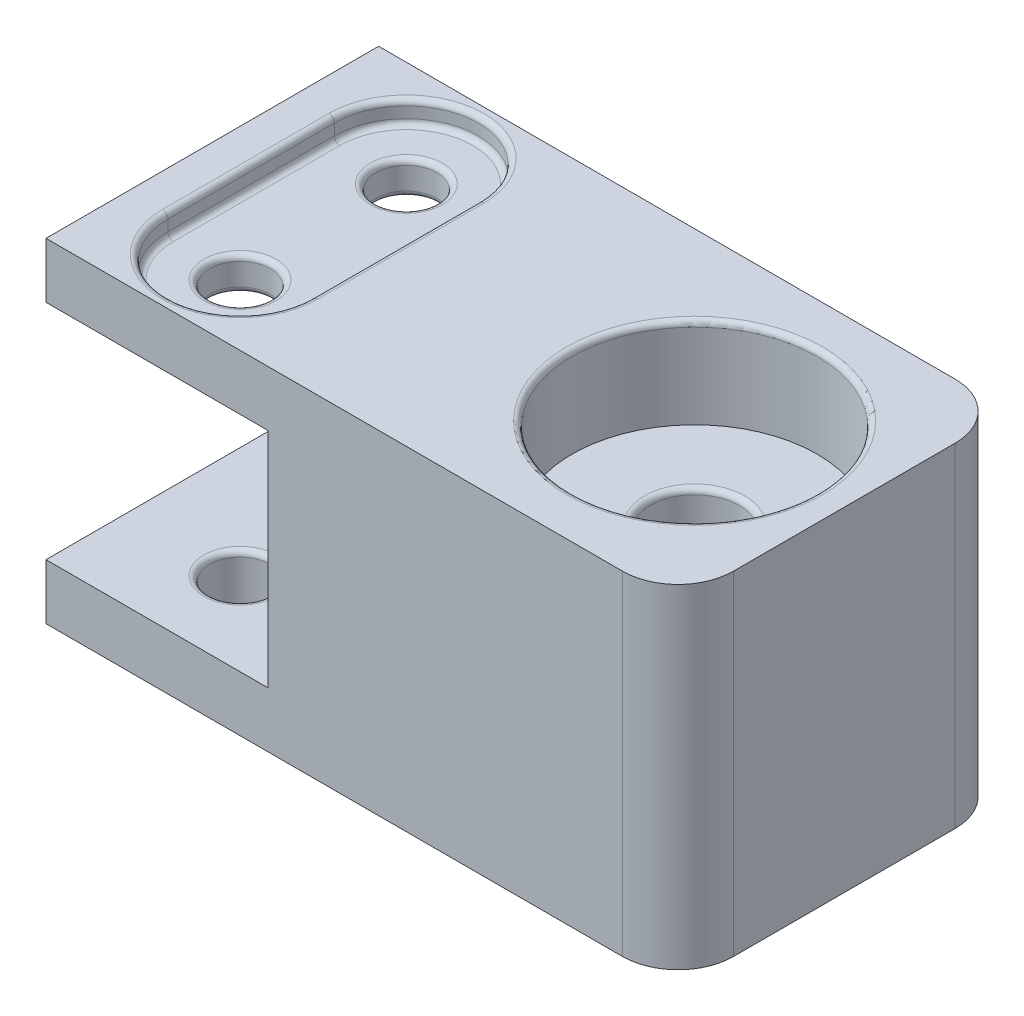
from build123d import *

# Parameters (mm, degrees)
SKETCH4_W           = 57
SKETCH4_H           = 30
BOSS_EXTRUDE2_DEPTH = 5
SKETCH5_W           = 37
SKETCH5_H           = 30
BOSS_EXTRUDE3_DEPTH = 20.1
BOSS_EXTRUDE4_DEPTH = 5
SKETCH7_R           = 2.75
CUT_EXTRUDE3_DEPTH  = 45.082422801
FILLET5_R           = 0.5
SKETCH8_R           = 11.049
CUT_EXTRUDE4_DEPTH  = 8.128
FILLET6_R           = 5
CUT_EXTRUDE5_START  = -8.128
SKETCH11_R          = 11.049
CUT_EXTRUDE5_DEPTH  = 8.128
SKETCH12_R          = 4.025
CUT_EXTRUDE6_DEPTH  = 39.987418278
FILLET7_R           = 0.5
CUT_EXTRUDE7_DEPTH  = 2
FILLET8_R           = 0.5


with BuildPart() as part:
    # Sketch4 → Boss-Extrude2 (new body)
    with BuildSketch(Plane(origin=(0, 0, 0), x_dir=(1, 0, 0), z_dir=(0, 1, 0))):
        Rectangle(SKETCH4_W, SKETCH4_H)
    extrude(amount=BOSS_EXTRUDE2_DEPTH)

    # Sketch5 → Boss-Extrude3 (add)
    with BuildSketch(Plane(origin=(0, 5, 0), x_dir=(1, 0, 0), z_dir=(0, 1, 0))):
        with Locations((10, 0)):
            Rectangle(SKETCH5_W, SKETCH5_H)
    extrude(amount=BOSS_EXTRUDE3_DEPTH)

    # Sketch6 → Boss-Extrude4 (add)
    with BuildSketch(Plane(origin=(0, 25.1, 0), x_dir=(1, 0, 0), z_dir=(0, 1, 0))):
        Polygon((28.5, -15), (28.5, 15), (-8.5, 15), (-28.5, 15), (-28.5, -15), (-8.5, -15), align=None)
    extrude(amount=BOSS_EXTRUDE4_DEPTH)

    # Sketch7 → Cut-Extrude3 (cut, through all)
    with BuildSketch(Plane(origin=(0, 30.1, 0), x_dir=(1, 0, 0), z_dir=(0, 1, 0))):
        with Locations((-18.5, -7.5)):
            Circle(SKETCH7_R)
        with Locations((-18.5, 7.5)):
            Circle(SKETCH7_R)
    extrude(amount=-CUT_EXTRUDE3_DEPTH, mode=Mode.SUBTRACT)

    # Fillet5
    fillet5_edges = [part.edges().sort_by_distance(p)[0] for p in [
        (-21.25, 5, -7.5),
        (-21.25, 0, -7.5),
        (-21.25, 5, 7.5),
        (-21.25, 0, 7.5),
        (-21.25, 25.1, -7.5),
        (-21.25, 30.1, -7.5),
        (-21.25, 25.1, 7.5),
        (-21.25, 30.1, 7.5),
    ]]
    fillet(fillet5_edges, radius=FILLET5_R)

    # Sketch8 → Cut-Extrude4 (cut)
    with BuildSketch(Plane(origin=(0, 30.1, 0), x_dir=(1, 0, 0), z_dir=(0, 1, 0))):
        with Locations((15, 0)):
            Circle(SKETCH8_R)
    extrude(amount=-CUT_EXTRUDE4_DEPTH, mode=Mode.SUBTRACT)

    # Fillet6
    fillet6_edges = [part.edges().sort_by_distance(p)[0] for p in [
        (28.5, 15.05, -15),
        (28.5, 15.05, 15),
    ]]
    fillet(fillet6_edges, radius=FILLET6_R)

    # Sketch11 → Cut-Extrude5 (cut)
    with BuildSketch(Plane.XZ.offset(CUT_EXTRUDE5_START)):
        with Locations((15, 0)):
            Circle(SKETCH11_R)
    extrude(amount=CUT_EXTRUDE5_DEPTH, mode=Mode.SUBTRACT)

    # Sketch12 → Cut-Extrude6 (cut, through all)
    with BuildSketch(Plane.XZ.offset(-8.128)):
        with Locations((15, 0)):
            Circle(SKETCH12_R)
    extrude(amount=-CUT_EXTRUDE6_DEPTH, mode=Mode.SUBTRACT)

    # Fillet7
    fillet7_edges = [part.edges().sort_by_distance(p)[0] for p in [
        (3.951, 30.1, 0),
        (10.975, 8.128, 0),
        (10.975, 21.972, 0),
        (3.951, 0, 0),
    ]]
    fillet(fillet7_edges, radius=FILLET7_R)

    # Sketch13 → Cut-Extrude7 (cut)
    with BuildSketch(Plane(origin=(0, 30.1, 0), x_dir=(1, 0, 0), z_dir=(0, 1, 0))):
        with BuildLine():
            Line((-25, -7.5), (-25, 7.5))
            ThreePointArc((-25, 7.5), (-18.5, 14), (-12, 7.5))
            Line((-12, 7.5), (-12, -7.5))
            ThreePointArc((-12, -7.5), (-18.5, -14), (-25, -7.5))
        make_face()
    extrude(amount=-CUT_EXTRUDE7_DEPTH, mode=Mode.SUBTRACT)

    # Fillet8
    fillet8_edges = [part.edges().sort_by_distance(p)[0] for p in [
        (-12, 28.1, 0),
        (-18.5, 28.1, 14),
        (-25, 28.1, 0),
        (-12, 30.1, 0),
        (-18.5, 30.1, 14),
        (-25, 30.1, 0),
        (-18.5, 28.1, -14),
        (-18.5, 30.1, -14),
        (-21.25, 28.1, 7.5),
        (-21.25, 28.1, -7.5),
    ]]
    fillet(fillet8_edges, radius=FILLET8_R)


solid = part.part
